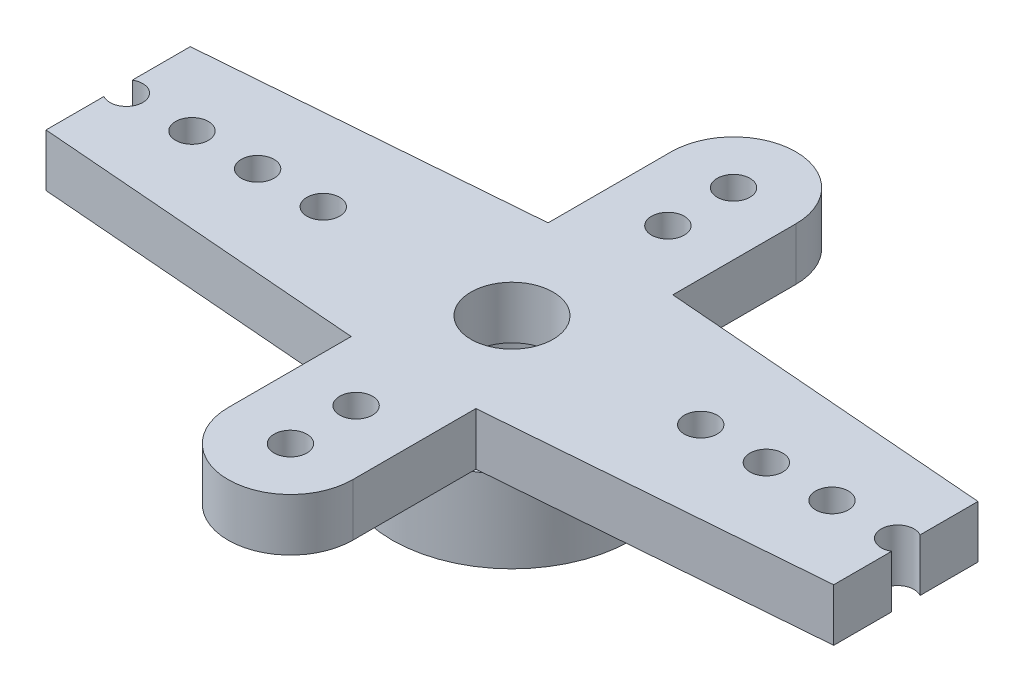
from build123d import *

# Parameters (mm, degrees)
SKETCH1_R           = 3.65
SKETCH1_R_2         = 2.5
BOSS_EXTRUDE1_DEPTH = 2.5
SKETCH2_R           = 1.25
BOSS_EXTRUDE2_DEPTH = 1.6
CUT_EXTRUDE1_REACH  = 22.079
SKETCH3_R           = 0.5
SKETCH4_W           = 8.285333373
SKETCH4_H           = 11.992925475
CUT_EXTRUDE2_DEPTH  = 21.078720079


with BuildPart() as part:
    # Sketch1 → Boss-Extrude1 (new body)
    with BuildSketch(Plane(origin=(0, 0, 0), x_dir=(1, 0, 0), z_dir=(0, 1, 0))):
        Circle(SKETCH1_R)
        Circle(SKETCH1_R_2, mode=Mode.SUBTRACT)
    extrude(amount=BOSS_EXTRUDE1_DEPTH)

    # Sketch2 → Boss-Extrude2 (add)
    with BuildSketch(Plane(origin=(0, 2.5, 0), x_dir=(1, 0, 0), z_dir=(0, 1, 0))):
        with BuildLine():
            Line((-1.9, 6.75), (-1.9, 3))
            Line((-1.9, 3), (-15.75, 1.9))
            ThreePointArc((-15.75, 1.9), (-17.65, 0), (-15.75, -1.9))
            Line((-15.75, -1.9), (-1.9, -3))
            Line((-1.9, -3), (-1.9, -6.75))
            ThreePointArc((-1.9, -6.75), (0, -8.65), (1.9, -6.75))
            Line((1.9, -6.75), (1.9, -3))
            Line((1.9, -3), (15.75, -1.9))
            ThreePointArc((15.75, -1.9), (17.65, 0), (15.75, 1.9))
            Line((15.75, 1.9), (1.9, 3))
            Line((1.9, 3), (1.9, 6.75))
            ThreePointArc((1.9, 6.75), (0, 8.65), (-1.9, 6.75))
        make_face()
        Circle(SKETCH2_R, mode=Mode.SUBTRACT)
    extrude(amount=BOSS_EXTRUDE2_DEPTH)

    # Sketch3 → Cut-Extrude1 (cut, up to next)
    with BuildSketch(Plane(origin=(0, 4.1, 0), x_dir=(1, 0, 0), z_dir=(0, 1, 0)), mode=Mode.PRIVATE) as cut_extrude1_sk1:
        with Locations((0, 6.75)):
            Circle(SKETCH3_R)
    cut_extrude1_tool1 = extrude(cut_extrude1_sk1.sketch, amount=-CUT_EXTRUDE1_REACH, mode=Mode.PRIVATE) & part.part
    # Sketch3 → Cut-Extrude1 (cut, up to next)
    with BuildSketch(Plane(origin=(0, 4.1, 0), x_dir=(1, 0, 0), z_dir=(0, 1, 0)), mode=Mode.PRIVATE) as cut_extrude1_sk2:
        with Locations((0, 4.75)):
            Circle(SKETCH3_R)
    cut_extrude1_tool2 = extrude(cut_extrude1_sk2.sketch, amount=-CUT_EXTRUDE1_REACH, mode=Mode.PRIVATE) & part.part
    # Sketch3 → Cut-Extrude1 (cut, up to next)
    with BuildSketch(Plane(origin=(0, 4.1, 0), x_dir=(1, 0, 0), z_dir=(0, 1, 0)), mode=Mode.PRIVATE) as cut_extrude1_sk3:
        with Locations((-15.75, 0)):
            Circle(SKETCH3_R)
    cut_extrude1_tool3 = extrude(cut_extrude1_sk3.sketch, amount=-CUT_EXTRUDE1_REACH, mode=Mode.PRIVATE) & part.part
    # Sketch3 → Cut-Extrude1 (cut, up to next)
    with BuildSketch(Plane(origin=(0, 4.1, 0), x_dir=(1, 0, 0), z_dir=(0, 1, 0)), mode=Mode.PRIVATE) as cut_extrude1_sk4:
        with Locations((-13.75, 0)):
            Circle(SKETCH3_R)
    cut_extrude1_tool4 = extrude(cut_extrude1_sk4.sketch, amount=-CUT_EXTRUDE1_REACH, mode=Mode.PRIVATE) & part.part
    # Sketch3 → Cut-Extrude1 (cut, up to next)
    with BuildSketch(Plane(origin=(0, 4.1, 0), x_dir=(1, 0, 0), z_dir=(0, 1, 0)), mode=Mode.PRIVATE) as cut_extrude1_sk5:
        with Locations((-11.75, 0)):
            Circle(SKETCH3_R)
    cut_extrude1_tool5 = extrude(cut_extrude1_sk5.sketch, amount=-CUT_EXTRUDE1_REACH, mode=Mode.PRIVATE) & part.part
    # Sketch3 → Cut-Extrude1 (cut, up to next)
    with BuildSketch(Plane(origin=(0, 4.1, 0), x_dir=(1, 0, 0), z_dir=(0, 1, 0)), mode=Mode.PRIVATE) as cut_extrude1_sk6:
        with Locations((-9.75, 0)):
            Circle(SKETCH3_R)
    cut_extrude1_tool6 = extrude(cut_extrude1_sk6.sketch, amount=-CUT_EXTRUDE1_REACH, mode=Mode.PRIVATE) & part.part
    # Sketch3 → Cut-Extrude1 (cut, up to next)
    with BuildSketch(Plane(origin=(0, 4.1, 0), x_dir=(1, 0, 0), z_dir=(0, 1, 0)), mode=Mode.PRIVATE) as cut_extrude1_sk7:
        with Locations((-7.75, 0)):
            Circle(SKETCH3_R)
    cut_extrude1_tool7 = extrude(cut_extrude1_sk7.sketch, amount=-CUT_EXTRUDE1_REACH, mode=Mode.PRIVATE) & part.part
    # Sketch3 → Cut-Extrude1 (cut, up to next)
    with BuildSketch(Plane(origin=(0, 4.1, 0), x_dir=(1, 0, 0), z_dir=(0, 1, 0)), mode=Mode.PRIVATE) as cut_extrude1_sk8:
        with Locations((-5.75, 0)):
            Circle(SKETCH3_R)
    cut_extrude1_tool8 = extrude(cut_extrude1_sk8.sketch, amount=-CUT_EXTRUDE1_REACH, mode=Mode.PRIVATE) & part.part
    # Sketch3 → Cut-Extrude1 (cut, up to next)
    with BuildSketch(Plane(origin=(0, 4.1, 0), x_dir=(1, 0, 0), z_dir=(0, 1, 0)), mode=Mode.PRIVATE) as cut_extrude1_sk9:
        with Locations((5.75, 0)):
            Circle(SKETCH3_R)
    cut_extrude1_tool9 = extrude(cut_extrude1_sk9.sketch, amount=-CUT_EXTRUDE1_REACH, mode=Mode.PRIVATE) & part.part
    # Sketch3 → Cut-Extrude1 (cut, up to next)
    with BuildSketch(Plane(origin=(0, 4.1, 0), x_dir=(1, 0, 0), z_dir=(0, 1, 0)), mode=Mode.PRIVATE) as cut_extrude1_sk10:
        with Locations((7.75, 0)):
            Circle(SKETCH3_R)
    cut_extrude1_tool10 = extrude(cut_extrude1_sk10.sketch, amount=-CUT_EXTRUDE1_REACH, mode=Mode.PRIVATE) & part.part
    # Sketch3 → Cut-Extrude1 (cut, up to next)
    with BuildSketch(Plane(origin=(0, 4.1, 0), x_dir=(1, 0, 0), z_dir=(0, 1, 0)), mode=Mode.PRIVATE) as cut_extrude1_sk11:
        with Locations((9.75, 0)):
            Circle(SKETCH3_R)
    cut_extrude1_tool11 = extrude(cut_extrude1_sk11.sketch, amount=-CUT_EXTRUDE1_REACH, mode=Mode.PRIVATE) & part.part
    # Sketch3 → Cut-Extrude1 (cut, up to next)
    with BuildSketch(Plane(origin=(0, 4.1, 0), x_dir=(1, 0, 0), z_dir=(0, 1, 0)), mode=Mode.PRIVATE) as cut_extrude1_sk12:
        with Locations((11.75, 0)):
            Circle(SKETCH3_R)
    cut_extrude1_tool12 = extrude(cut_extrude1_sk12.sketch, amount=-CUT_EXTRUDE1_REACH, mode=Mode.PRIVATE) & part.part
    # Sketch3 → Cut-Extrude1 (cut, up to next)
    with BuildSketch(Plane(origin=(0, 4.1, 0), x_dir=(1, 0, 0), z_dir=(0, 1, 0)), mode=Mode.PRIVATE) as cut_extrude1_sk13:
        with Locations((13.75, 0)):
            Circle(SKETCH3_R)
    cut_extrude1_tool13 = extrude(cut_extrude1_sk13.sketch, amount=-CUT_EXTRUDE1_REACH, mode=Mode.PRIVATE) & part.part
    # Sketch3 → Cut-Extrude1 (cut, up to next)
    with BuildSketch(Plane(origin=(0, 4.1, 0), x_dir=(1, 0, 0), z_dir=(0, 1, 0)), mode=Mode.PRIVATE) as cut_extrude1_sk14:
        with Locations((15.75, 0)):
            Circle(SKETCH3_R)
    cut_extrude1_tool14 = extrude(cut_extrude1_sk14.sketch, amount=-CUT_EXTRUDE1_REACH, mode=Mode.PRIVATE) & part.part
    # Sketch3 → Cut-Extrude1 (cut, up to next)
    with BuildSketch(Plane(origin=(0, 4.1, 0), x_dir=(1, 0, 0), z_dir=(0, 1, 0)), mode=Mode.PRIVATE) as cut_extrude1_sk15:
        with Locations((0, -4.75)):
            Circle(SKETCH3_R)
    cut_extrude1_tool15 = extrude(cut_extrude1_sk15.sketch, amount=-CUT_EXTRUDE1_REACH, mode=Mode.PRIVATE) & part.part
    # Sketch3 → Cut-Extrude1 (cut, up to next)
    with BuildSketch(Plane(origin=(0, 4.1, 0), x_dir=(1, 0, 0), z_dir=(0, 1, 0)), mode=Mode.PRIVATE) as cut_extrude1_sk16:
        with Locations((0, -6.75)):
            Circle(SKETCH3_R)
    cut_extrude1_tool16 = extrude(cut_extrude1_sk16.sketch, amount=-CUT_EXTRUDE1_REACH, mode=Mode.PRIVATE) & part.part
    add(cut_extrude1_tool1.solids().sort_by_distance((0, 4.1, -6.75))[0], mode=Mode.SUBTRACT)
    add(cut_extrude1_tool2.solids().sort_by_distance((0, 4.1, -4.75))[0], mode=Mode.SUBTRACT)
    add(cut_extrude1_tool3.solids().sort_by_distance((-15.75, 4.1, 0))[0], mode=Mode.SUBTRACT)
    add(cut_extrude1_tool4.solids().sort_by_distance((-13.75, 4.1, 0))[0], mode=Mode.SUBTRACT)
    add(cut_extrude1_tool5.solids().sort_by_distance((-11.75, 4.1, 0))[0], mode=Mode.SUBTRACT)
    add(cut_extrude1_tool6.solids().sort_by_distance((-9.75, 4.1, 0))[0], mode=Mode.SUBTRACT)
    add(cut_extrude1_tool7.solids().sort_by_distance((-7.75, 4.1, 0))[0], mode=Mode.SUBTRACT)
    add(cut_extrude1_tool8.solids().sort_by_distance((-5.75, 4.1, 0))[0], mode=Mode.SUBTRACT)
    add(cut_extrude1_tool9.solids().sort_by_distance((5.75, 4.1, 0))[0], mode=Mode.SUBTRACT)
    add(cut_extrude1_tool10.solids().sort_by_distance((7.75, 4.1, 0))[0], mode=Mode.SUBTRACT)
    add(cut_extrude1_tool11.solids().sort_by_distance((9.75, 4.1, 0))[0], mode=Mode.SUBTRACT)
    add(cut_extrude1_tool12.solids().sort_by_distance((11.75, 4.1, 0))[0], mode=Mode.SUBTRACT)
    add(cut_extrude1_tool13.solids().sort_by_distance((13.75, 4.1, 0))[0], mode=Mode.SUBTRACT)
    add(cut_extrude1_tool14.solids().sort_by_distance((15.75, 4.1, 0))[0], mode=Mode.SUBTRACT)
    add(cut_extrude1_tool15.solids().sort_by_distance((0, 4.1, 4.75))[0], mode=Mode.SUBTRACT)
    add(cut_extrude1_tool16.solids().sort_by_distance((0, 4.1, 6.75))[0], mode=Mode.SUBTRACT)

    # Sketch4 → Cut-Extrude2 (cut, through all)
    with BuildSketch(Plane(origin=(0, 4.1, 0), x_dir=(1, 0, 0), z_dir=(0, 1, 0))):
        with Locations((-16.142666687, 0.926898026)):
            Rectangle(SKETCH4_W, SKETCH4_H)
        with Locations((16.142666687, 0.926898026)):
            Rectangle(SKETCH4_W, SKETCH4_H)
    extrude(amount=-CUT_EXTRUDE2_DEPTH, mode=Mode.SUBTRACT)


solid = part.part
